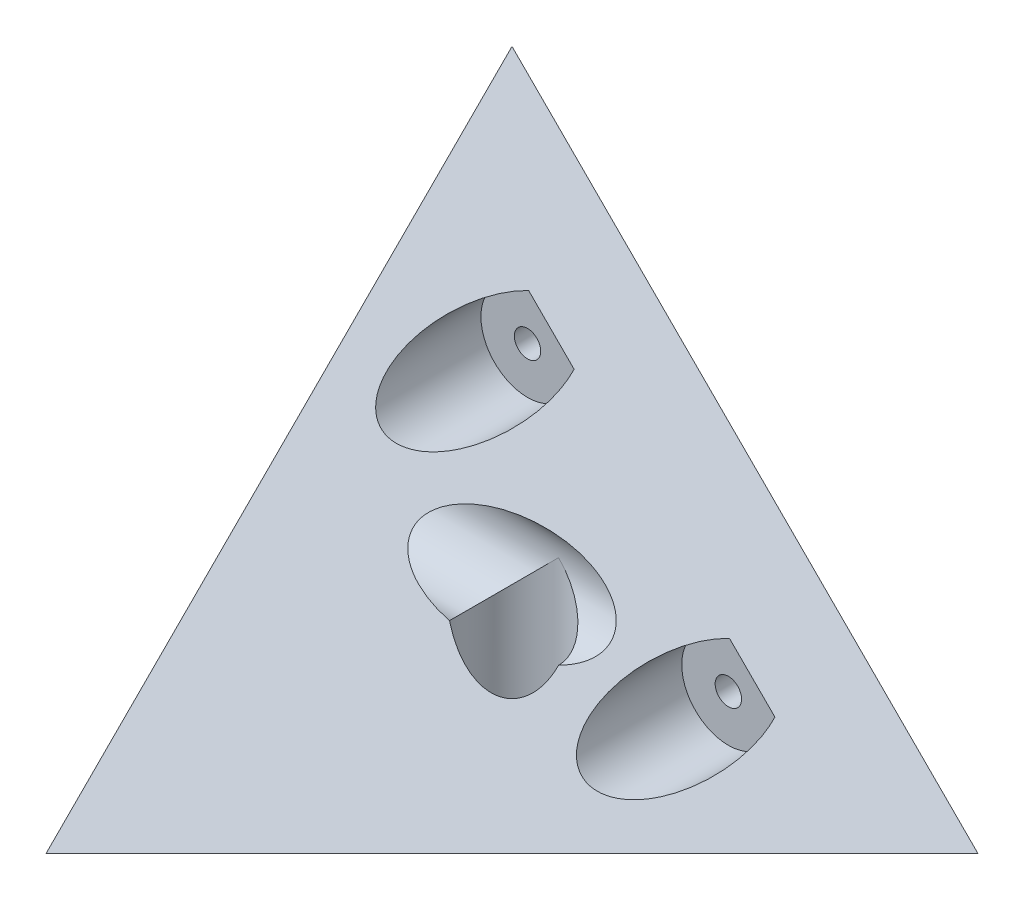
from build123d import *

# Parameters (mm, degrees)
CROQUIS1_W              = 30
CROQUIS1_H              = 30
CROQUIS1_R              = 0.85
SALIENTE_EXTRUIR1_DEPTH = 30
CHAFL_N1_START          = 17.320508076
CHAFL_N1_OUTLINE_W      = 52
CHAFL_N1_OUTLINE_H      = 46
CHAFL_N1_DEPTH          = 35.679491924
CORTAR_EXTRUIR1_REACH   = 51.759
CROQUIS2_R              = 3
CORTAR_EXTRUIR2_REACH   = 53.962
CROQUIS3_R              = 3
SALIENTE_EXTRUIR2_DEPTH = 2.5
REDONDEO1_R             = 2.5
CORTAR_EXTRUIR3_REACH   = 53.962
CROQUIS5_R              = 3


with BuildPart() as part:
    # Croquis1 → Saliente-Extruir1 (new body)
    with BuildSketch(Plane.XY):
        with Locations((15, 15)):
            Rectangle(CROQUIS1_W, CROQUIS1_H)
        with Locations((5, 17.928932188)):
            Circle(CROQUIS1_R, mode=Mode.SUBTRACT)
        with Locations((17.928932188, 5)):
            Circle(CROQUIS1_R, mode=Mode.SUBTRACT)
    extrude(amount=SALIENTE_EXTRUIR1_DEPTH)

    # Chaflán1: read off the stored shape, not the designer's step
    # Chaflán1 outline → Chaflán1 (cut)
    with BuildSketch(Plane(origin=(0, 0, 0), x_dir=(0.8164965809277258, -0.4082482904638636, -0.40824829046386285), z_dir=(0.5773502691896261, 0.5773502691896261, 0.5773502691896251)).offset(CHAFL_N1_START)):
        Rectangle(CHAFL_N1_OUTLINE_W, CHAFL_N1_OUTLINE_H)
    extrude(amount=CHAFL_N1_DEPTH, mode=Mode.SUBTRACT)

    # Croquis2 → Cortar-Extruir1 (cut, up to next)
    with BuildSketch(Plane(origin=(0, 0, 4), x_dir=(-1, 0, 0), z_dir=(0, 0, -1)), mode=Mode.PRIVATE) as cortar_extruir1_sk1:
        with Locations((-5, 17.928932188)):
            Circle(CROQUIS2_R)
    cortar_extruir1_tool1 = extrude(cortar_extruir1_sk1.sketch, amount=-CORTAR_EXTRUIR1_REACH, mode=Mode.PRIVATE) & part.part
    # Croquis2 → Cortar-Extruir1 (cut, up to next)
    with BuildSketch(Plane(origin=(0, 0, 4), x_dir=(-1, 0, 0), z_dir=(0, 0, -1)), mode=Mode.PRIVATE) as cortar_extruir1_sk2:
        with Locations((-17.928932188, 5)):
            Circle(CROQUIS2_R)
    cortar_extruir1_tool2 = extrude(cortar_extruir1_sk2.sketch, amount=-CORTAR_EXTRUIR1_REACH, mode=Mode.PRIVATE) & part.part
    add(cortar_extruir1_tool1.solids().sort_by_distance((5, 17.928932, 4))[0], mode=Mode.SUBTRACT)
    add(cortar_extruir1_tool2.solids().sort_by_distance((17.928932, 5, 4))[0], mode=Mode.SUBTRACT)

    # Cortar-Extruir2: up to this plane
    cortar_extruir2_end = Plane(origin=(0, 0, 30), z_dir=(0.5773502691896264, 0.5773502691896264, 0.5773502691896246))
    # Croquis3 → Cortar-Extruir2 (cut, up to the surface)
    with BuildSketch(Plane.ZY, mode=Mode.PRIVATE) as cortar_extruir2_sk1:
        with Locations((10, 10)):
            Circle(CROQUIS3_R)
    cortar_extruir2_tool1 = split(extrude(cortar_extruir2_sk1.sketch, amount=-CORTAR_EXTRUIR2_REACH, mode=Mode.PRIVATE), bisect_by=cortar_extruir2_end, keep=Keep.BOTH, mode=Mode.PRIVATE)
    add(cortar_extruir2_tool1.solids().sort_by_distance((0, 10, 10))[0], mode=Mode.SUBTRACT)

    # Croquis4 → Saliente-Extruir2 (add)
    with BuildSketch(Plane(origin=(0, 0, 0), x_dir=(-1, 0, 0), z_dir=(0, 0, -1))):
        with BuildLine():
            Line((-11, 7.5), (-5, 7.5))
            ThreePointArc((-5, 7.5), (-2.5, 5), (-5, 2.5))
            Line((-5, 2.5), (-11, 2.5))
            ThreePointArc((-11, 2.5), (-13.5, 5), (-11, 7.5))
        make_face()
    extrude(amount=SALIENTE_EXTRUIR2_DEPTH)

    # Redondeo1
    redondeo1_edges = [part.edges().sort_by_distance(p)[0] for p in [
        (8, 7.5, -2.5),
        (2.5, 5, -2.5),
        (8, 2.5, -2.5),
        (13.5, 5, -2.5),
    ]]
    fillet(redondeo1_edges, radius=REDONDEO1_R - 0.0001)  # a hair under: the kernel refuses the full size

    # Croquis5 → Cortar-Extruir3 (cut, up to next)
    with BuildSketch(Plane.XZ, mode=Mode.PRIVATE) as cortar_extruir3_sk1:
        with Locations(Location((10, 10, 0), (0, 0, 270))):
            Circle(CROQUIS5_R)
    cortar_extruir3_tool1 = extrude(cortar_extruir3_sk1.sketch, amount=-CORTAR_EXTRUIR3_REACH, mode=Mode.PRIVATE) & part.part
    add(cortar_extruir3_tool1.solids().sort_by_distance((10, 0, 10))[0], mode=Mode.SUBTRACT)


solid = part.part
